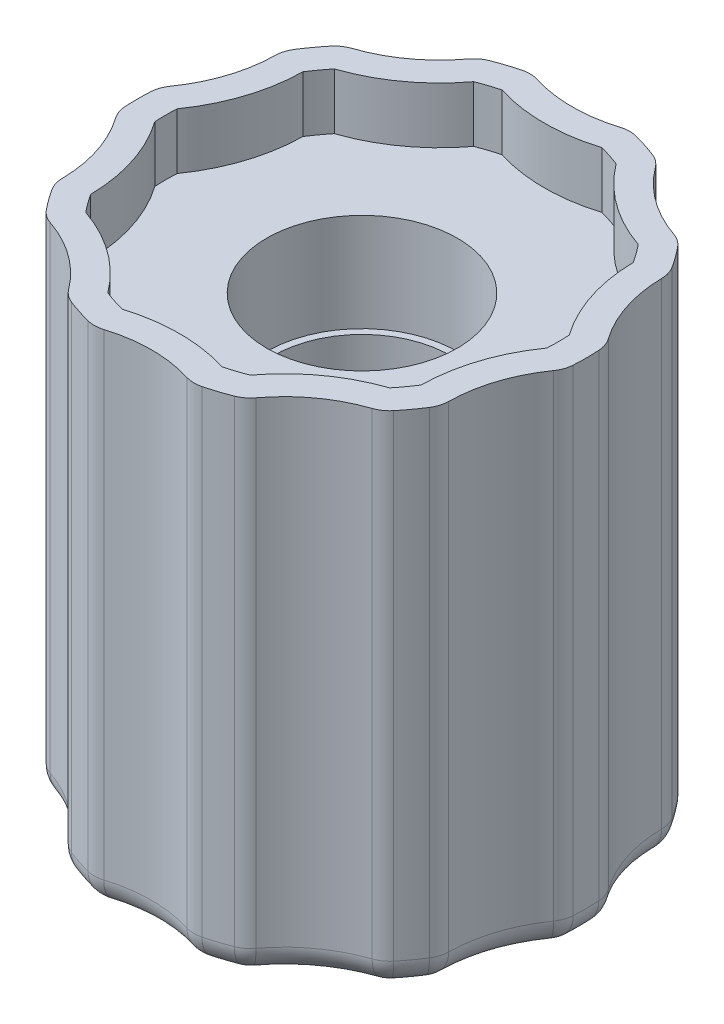
from build123d import *

# Parameters (mm, degrees)
ESQUISSE1_R                  = 8
BOSS_EXTRU_1_DEPTH           = 16
ENL_V_MAT_EXTRU_1_DEPTH      = 10
ESQUISSE3_R                  = 5
ENL_V_MAT_EXTRU_2_DEPTH      = 20.595917942
R_P_TITION_CIRCULAIRE1_COUNT = 10
CONG_1_R                     = 1
CONG_2_R                     = 1
BOSS_EXTRU_2_DEPTH           = 2
ESQUISSE5_R                  = 3.4
ENL_V_MAT_EXTRU_3_DEPTH      = 3.5
ESQUISSE6_R                  = 0.5
ENL_V_MAT_EXTRU_4_DEPTH      = 6.5
CONG_3_R                     = 2


# Some blends are built 0.0001 mm under size
with BuildPart() as part:
    # Esquisse1 → Boss.-Extru.1 (new body)
    with BuildSketch(Plane(origin=(0, 0, 0), x_dir=(1, 0, 0), z_dir=(0, 1, 0))):
        with Locations(Location((0, 0, 0), (0, 0, 270))):
            Circle(ESQUISSE1_R)
    extrude(amount=BOSS_EXTRU_1_DEPTH)

    # Esquisse2 → Enlèv. mat.-Extru.1 (cut)
    with BuildSketch(Plane(origin=(0, 16, 0), x_dir=(1, 0, 0), z_dir=(0, 1, 0))):
        with BuildLine():
            ThreePointArc((0, 3.15), (-2.720753572, 1.587450787), (-2.74226184, -1.55))
            Line((-2.74226184, -1.55), (0, -1.55))
            Line((0, -1.55), (0, 3.15))
        make_face()
        with BuildLine():
            Line((0, 3.15), (0, -1.55))
            Line((0, -1.55), (2.74226184, -1.55))
            ThreePointArc((2.74226184, -1.55), (3.046360517, -0.801366085), (3.15, 0))
            ThreePointArc((3.15, 0), (2.227386361, 2.227386361), (0, 3.15))
        make_face()
    extrude(amount=-ENL_V_MAT_EXTRU_1_DEPTH, mode=Mode.SUBTRACT)

    # Esquisse3 → Enlèv. mat.-Extru.2 (cut, through all)
    with BuildSketch(Plane(origin=(0, 16, 0), x_dir=(1, 0, 0), z_dir=(0, 1, 0))):
        with Locations((0, 12.5)):
            Circle(ESQUISSE3_R)
    enl_v_mat_extru_2 = extrude(amount=-ENL_V_MAT_EXTRU_2_DEPTH, mode=Mode.SUBTRACT)

    # Répétition circulaire1: Enlèv. mat.-Extru.2 ×10 about axis
    r_p_tition_circulaire1_axis = Axis((0, 0, 0), (0, 1, 0))
    for i in range(1, R_P_TITION_CIRCULAIRE1_COUNT):
        add(enl_v_mat_extru_2.rotate(r_p_tition_circulaire1_axis, i * 360 / R_P_TITION_CIRCULAIRE1_COUNT), mode=Mode.SUBTRACT)

    # Congé1
    cong_1_edges = [part.edges().sort_by_distance(p)[0] for p in [
        (1.733176275, 8, -7.81),
        (-1.733176275, 8, -7.81),
        (-3.18843376, 8, -7.33715818),
        (-5.992771881, 8, -5.299687272),
        (-6.892170469, 8, -4.061771316),
        (-7.963332315, 8, -0.765074136),
        (-1.733176275, 8, 7.81),
        (1.733176275, 8, 7.81),
        (-7.963332315, 8, 0.765074136),
        (-6.892170469, 8, 4.061771316),
        (-5.992771881, 8, 5.299687272),
        (-3.18843376, 8, 7.33715818),
        (3.18843376, 8, 7.33715818),
        (5.992771881, 8, 5.299687272),
        (6.892170469, 8, 4.061771316),
        (7.963332315, 8, 0.765074136),
        (7.963332315, 8, -0.765074136),
        (6.892170469, 8, -4.061771316),
        (5.992771881, 8, -5.299687272),
        (3.18843376, 8, -7.33715818),
    ]]
    fillet(cong_1_edges, radius=CONG_1_R)

    # Congé2
    cong_2_edges = [part.edges().sort_by_distance(p)[0] for p in [
        (-2.472135955, 0, -7.60845213),
        (-6.472135955, 0, -4.702282018),
        (-4.408389392, 0, -6.067627458),
        (0, 0, -7.5),
        (2.472135955, 0, -7.60845213),
        (4.408389392, 0, -6.067627458),
        (6.472135955, 0, -4.702282018),
        (7.132923872, 0, -2.317627458),
        (8, 0, 0),
        (7.132923872, 0, 2.317627458),
        (6.472135955, 0, 4.702282018),
        (4.408389392, 0, 6.067627458),
        (2.472135955, 0, 7.60845213),
        (0, 0, 7.5),
        (-2.472135955, 0, 7.60845213),
        (-4.408389392, 0, 6.067627458),
        (-6.472135955, 0, 4.702282018),
        (-7.132923872, 0, 2.317627458),
        (-8, 0, 0),
        (-7.132923872, 0, -2.317627458),
        (-6.846351136, 0, -4.072559992),
        (-5.988873569, 0, -5.252776613),
        (-3.145023717, 0, -7.318954474),
        (-7.932605121, 0, -0.729413986),
        (-7.932605121, 0, 0.729413986),
        (-6.846351136, 0, 4.072559992),
        (-5.988873569, 0, 5.252776613),
        (-3.145023717, 0, 7.318954474),
        (-1.757595867, 0, 7.769757109),
        (1.757595867, 0, 7.769757109),
        (3.145023717, 0, 7.318954474),
        (5.988873569, 0, 5.252776613),
        (6.846351136, 0, 4.072559992),
        (7.932605121, 0, 0.729413986),
        (7.932605121, 0, -0.729413986),
        (6.846351136, 0, -4.072559992),
        (5.988873569, 0, -5.252776613),
        (3.145023717, 0, -7.318954474),
        (1.757595867, 0, -7.769757109),
        (-1.757595867, 0, -7.769757109),
    ]]
    fillet(cong_2_edges, radius=CONG_2_R - 0.0001)  # a hair under: the kernel refuses the full size

    # Esquisse4 → Boss.-Extru.2 (add)
    with BuildSketch(Plane(origin=(0, 16, 0), x_dir=(1, 0, 0), z_dir=(0, 1, 0))):
        with BuildLine():
            ThreePointArc((-1.483028995, 7.725), (0, 7.5), (1.483028995, 7.725))
            ThreePointArc((1.483028995, 7.725), (1.757595867, 7.769757113), (2.033868336, 7.737142857))
            ThreePointArc((2.033868336, 7.737142857), (2.472135955, 7.60845213), (2.902344418, 7.454957872))
            ThreePointArc((2.902344418, 7.454957872), (3.145023719, 7.318954477), (3.340845414, 7.121358854))
            ThreePointArc((3.340845414, 7.121358854), (4.408389392, 6.067627458), (5.740436734, 5.37795371))
            ThreePointArc((5.740436734, 5.37795371), (5.988873571, 5.252776617), (6.193212514, 5.064002246))
            ThreePointArc((6.193212514, 5.064002246), (6.472135955, 4.702282018), (6.729960252, 4.325232365))
            ThreePointArc((6.729960252, 4.325232365), (6.84635114, 4.072559993), (6.888630426, 3.797600671))
            ThreePointArc((6.888630426, 3.797600671), (7.132923872, 2.317627458), (7.805192751, 0.976711892))
            ThreePointArc((7.805192751, 0.976711892), (7.932605125, 0.729413987), (7.986960012, 0.456584897))
            ThreePointArc((7.986960012, 0.456584897), (8, 0), (7.986960012, -0.456584897))
            ThreePointArc((7.986960012, -0.456584897), (7.932605125, -0.729413987), (7.805192751, -0.976711892))
            ThreePointArc((7.805192751, -0.976711892), (7.132923872, -2.317627458), (6.888630426, -3.797600671))
            ThreePointArc((6.888630426, -3.797600671), (6.84635114, -4.072559993), (6.729960252, -4.325232365))
            ThreePointArc((6.729960252, -4.325232365), (6.472135955, -4.702282018), (6.193212514, -5.064002246))
            ThreePointArc((6.193212514, -5.064002246), (5.988873571, -5.252776617), (5.740436734, -5.37795371))
            ThreePointArc((5.740436734, -5.37795371), (4.408389392, -6.067627458), (3.340845414, -7.121358854))
            ThreePointArc((3.340845414, -7.121358854), (3.145023719, -7.318954477), (2.902344418, -7.454957872))
            ThreePointArc((2.902344418, -7.454957872), (2.472135955, -7.60845213), (2.033868336, -7.737142857))
            ThreePointArc((2.033868336, -7.737142857), (1.757595867, -7.769757113), (1.483028995, -7.725))
            ThreePointArc((1.483028995, -7.725), (0, -7.5), (-1.483028995, -7.725))
            ThreePointArc((-1.483028995, -7.725), (-1.757595867, -7.769757113), (-2.033868336, -7.737142857))
            ThreePointArc((-2.033868336, -7.737142857), (-2.472135955, -7.60845213), (-2.902344418, -7.454957872))
            ThreePointArc((-2.902344418, -7.454957872), (-3.145023719, -7.318954477), (-3.340845414, -7.121358854))
            ThreePointArc((-3.340845414, -7.121358854), (-4.408389392, -6.067627458), (-5.740436734, -5.37795371))
            ThreePointArc((-5.740436734, -5.37795371), (-5.988873571, -5.252776617), (-6.193212514, -5.064002246))
            ThreePointArc((-6.193212514, -5.064002246), (-6.472135955, -4.702282018), (-6.729960252, -4.325232365))
            ThreePointArc((-6.729960252, -4.325232365), (-6.84635114, -4.072559993), (-6.888630426, -3.797600671))
            ThreePointArc((-6.888630426, -3.797600671), (-7.132923872, -2.317627458), (-7.805192751, -0.976711892))
            ThreePointArc((-7.805192751, -0.976711892), (-7.932605125, -0.729413987), (-7.986960012, -0.456584897))
            ThreePointArc((-7.986960012, -0.456584897), (-8, 0), (-7.986960012, 0.456584897))
            ThreePointArc((-7.986960012, 0.456584897), (-7.932605125, 0.729413987), (-7.805192751, 0.976711892))
            ThreePointArc((-7.805192751, 0.976711892), (-7.132923872, 2.317627458), (-6.888630426, 3.797600671))
            ThreePointArc((-6.888630426, 3.797600671), (-6.84635114, 4.072559993), (-6.729960252, 4.325232365))
            ThreePointArc((-6.729960252, 4.325232365), (-6.472135955, 4.702282018), (-6.193212514, 5.064002246))
            ThreePointArc((-6.193212514, 5.064002246), (-5.988873571, 5.252776617), (-5.740436734, 5.37795371))
            ThreePointArc((-5.740436734, 5.37795371), (-4.408389392, 6.067627458), (-3.340845414, 7.121358854))
            ThreePointArc((-3.340845414, 7.121358854), (-3.145023719, 7.318954477), (-2.902344418, 7.454957872))
            ThreePointArc((-2.902344418, 7.454957872), (-2.472135955, 7.60845213), (-2.033868336, 7.737142857))
            ThreePointArc((-2.033868336, 7.737142857), (-1.757595867, 7.769757113), (-1.483028995, 7.725))
        make_face()
        with BuildLine():
            ThreePointArc((-6.98859001, 0.399511784), (-6.181867356, 2.008610463), (-5.88871522, 3.784578319))
            ThreePointArc((-5.88871522, 3.784578319), (-5.663118961, 4.114496766), (-5.41906095, 4.431001966))
            ThreePointArc((-5.41906095, 4.431001966), (-3.82060414, 5.258610463), (-2.539551366, 6.523088138))
            ThreePointArc((-2.539551366, 6.523088138), (-2.163118961, 6.657395614), (-1.779634794, 6.77))
            ThreePointArc((-1.779634794, 6.77), (0, 6.5), (1.779634794, 6.77))
            ThreePointArc((1.779634794, 6.77), (2.163118961, 6.657395614), (2.539551366, 6.523088138))
            ThreePointArc((2.539551366, 6.523088138), (3.82060414, 5.258610463), (5.41906095, 4.431001966))
            ThreePointArc((5.41906095, 4.431001966), (5.663118961, 4.114496766), (5.88871522, 3.784578319))
            ThreePointArc((5.88871522, 3.784578319), (6.181867356, 2.008610463), (6.98859001, 0.399511784))
            ThreePointArc((6.98859001, 0.399511784), (7, 0), (6.98859001, -0.399511784))
            ThreePointArc((6.98859001, -0.399511784), (6.181867356, -2.008610463), (5.88871522, -3.784578319))
            ThreePointArc((5.88871522, -3.784578319), (5.663118961, -4.114496766), (5.41906095, -4.431001966))
            ThreePointArc((5.41906095, -4.431001966), (3.82060414, -5.258610463), (2.539551366, -6.523088138))
            ThreePointArc((2.539551366, -6.523088138), (2.163118961, -6.657395614), (1.779634794, -6.77))
            ThreePointArc((1.779634794, -6.77), (0, -6.5), (-1.779634794, -6.77))
            ThreePointArc((-1.779634794, -6.77), (-2.163118961, -6.657395614), (-2.539551366, -6.523088138))
            ThreePointArc((-2.539551366, -6.523088138), (-3.82060414, -5.258610463), (-5.41906095, -4.431001966))
            ThreePointArc((-5.41906095, -4.431001966), (-5.663118961, -4.114496766), (-5.88871522, -3.784578319))
            ThreePointArc((-5.88871522, -3.784578319), (-6.181867356, -2.008610463), (-6.98859001, -0.399511784))
            ThreePointArc((-6.98859001, -0.399511784), (-7, 0), (-6.98859001, 0.399511784))
        make_face(mode=Mode.SUBTRACT)
    extrude(amount=BOSS_EXTRU_2_DEPTH)

    # Esquisse5 → Enlèv. mat.-Extru.3 (cut)
    with BuildSketch(Plane(origin=(0, 16, 0), x_dir=(1, 0, 0), z_dir=(0, 1, 0))):
        with Locations(Location((0, 0, 0), (0, 0, 270))):
            Circle(ESQUISSE5_R)
    extrude(amount=-ENL_V_MAT_EXTRU_3_DEPTH, mode=Mode.SUBTRACT)

    # Esquisse6 → Enlèv. mat.-Extru.4 (cut)
    with BuildSketch(Plane(origin=(0, 12.5, 0), x_dir=(1, 0, 0), z_dir=(0, 1, 0))):
        with Locations((0, -1.55)):
            Circle(ESQUISSE6_R)
    extrude(amount=-ENL_V_MAT_EXTRU_4_DEPTH, mode=Mode.SUBTRACT)

    # Congé3
    # the kernel refuses this fillet: 2 mm, written as the material it takes off along each edge
    with BuildSketch(Plane(origin=(-0.5, 6, 1.55), x_dir=(-1, 0, 0), z_dir=(0, 1, 0))) as cong_3_piece_1:
        with BuildLine():
            CenterArc((1, 2), CONG_3_R, 233.130102354, 36.869897646)
            ThreePointArc((-0.2, 0.4), (-0.052786405, 0.223606798), (0, 0))
            Line((0, 0), (1, 0))
        make_face()
    extrude(amount=9, mode=Mode.SUBTRACT)
    with BuildSketch(Plane(origin=(0.5, 15, 1.55), x_dir=(-0.4472135954998809, 0, 0.8944271909999544), z_dir=(0, -1, 0))) as cong_3_piece_2:
        with BuildLine():
            CenterArc((1.341640786, -1.788854382), CONG_3_R, 116.565051177, 36.869897646)
            Line((-0.447213596, -0.894427191), (0, 0))
            ThreePointArc((0, 0), (0.223606798, -0.052786405), (0.447213595, 0))
        make_face()
    extrude(amount=9, mode=Mode.SUBTRACT)


solid = part.part
